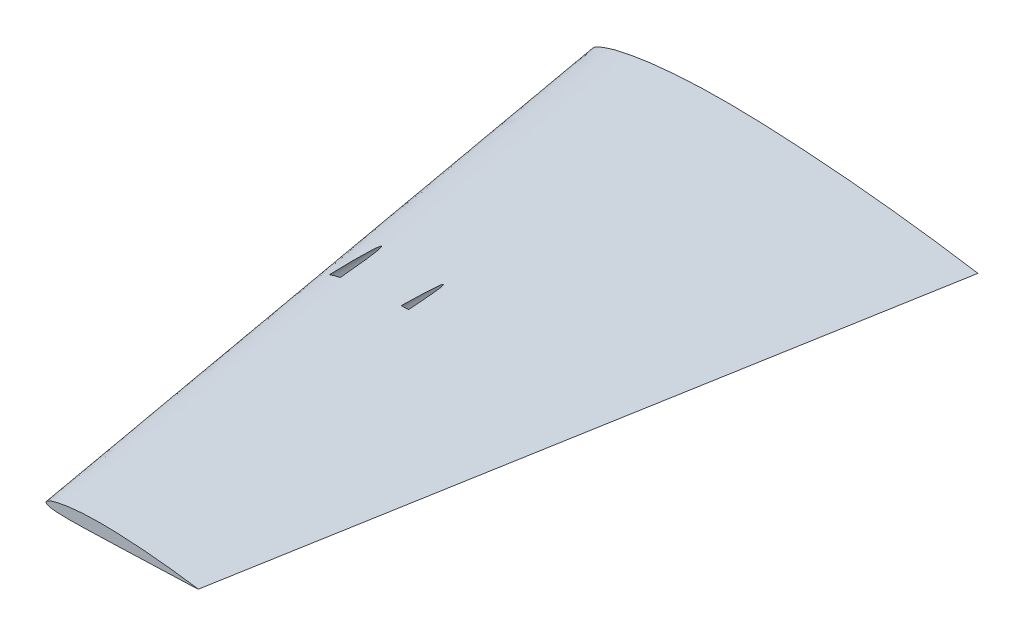
from build123d import *

# Parameters (mm, degrees)
SKETCH10_R         = 3.556
CUT_EXTRUDE1_DEPTH = 152.4


with BuildPart() as part:
    # Sketch8 → Loft1 section 0
    with BuildSketch(Plane.XY):
        with BuildLine():
            Line((168.851326, -0.385826), (177.8, 0.149352))
            add(Edge.make_bspline(
                [(177.8, 0.149352), (174.85719505, 0.612681625), (168.969063902, 1.539737833), (157.168969239, 3.240587373), (142.387066218, 5.13954993), (124.612423324, 7.068513988), (106.806810583, 8.63772838), (88.975151697, 9.799607557), (71.092038413, 10.550321324), (56.151211558, 10.603824175), (44.182140186, 10.140101011), (35.213135868, 9.51281635), (26.259336774, 8.559807876), (18.830232793, 7.418999987), (12.913992759, 6.19236398), (8.487379341, 5.125518549), (4.793933355, 3.700021616), (1.828725111, 2.565322597), (-1.179273917, -0.123552283), (2.299923854, -2.129309552), (5.372172766, -2.815648506), (9.249075669, -3.41893056), (13.717870066, -3.774996411), (19.665331559, -4.065076307), (27.050573326, -4.189635193), (35.893379779, -4.142482213), (44.710709428, -3.990841299), (56.450763234, -3.71017542), (71.156708176, -3.327900411), (88.837724704, -2.833388525), (106.56851179, -2.244577125), (124.325007347, -1.669961057), (142.113106472, -1.122128513), (156.958652889, -0.706609276), (165.875537757, -0.466092488), (168.851326, -0.385826)],
                knots=[0, 0, 0, 0, 0.025515847, 0.051053555, 0.102111638, 0.153156699, 0.204180549, 0.255198388, 0.306198821, 0.357469284, 0.383114063, 0.40877782, 0.434465464, 0.460211087, 0.473144435, 0.486143689, 0.499400539, 0.50617272, 0.51522045, 0.524256147, 0.531058294, 0.544124426, 0.556970371, 0.569702534, 0.595038372, 0.620262586, 0.645429078, 0.670573489, 0.720845486, 0.771430884, 0.82207272, 0.872795898, 0.923597706, 0.974502637, 1, 1, 1, 1], degree=3))
        make_face()
    # Sketch9 → Loft1 section 1
    with BuildSketch(Plane.XY.offset(304.8)):
        with BuildLine():
            Line((120.424928473, -0.441094427), (123.952, -0.210449087))
            add(Edge.make_bspline(
                [(123.952, -0.210449087), (122.790706344, -0.034227303), (120.467124094, 0.318367243), (115.810899398, 0.963076187), (109.978584953, 1.679352822), (102.966239644, 2.40089085), (95.942473132, 2.980520314), (88.909331139, 3.399490187), (81.856804208, 3.656234557), (75.965879739, 3.644542263), (71.247781696, 3.435441672), (67.712896541, 3.168436286), (64.184721229, 2.773039238), (61.258108484, 2.306943314), (58.928169788, 1.810327369), (57.185204224, 1.379981926), (55.732095913, 0.809837774), (54.565476004, 0.355946309), (53.385395312, -0.710813052), (54.761560507, -1.493999694), (55.974380176, -1.757864608), (57.504273209, -1.987216405), (59.266992249, -2.117797938), (61.612569196, -2.219117915), (64.524664938, -2.252021794), (68.011066404, -2.214025251), (71.487193687, -2.13488755), (76.115397351, -1.998464595), (81.912757256, -1.81547106), (88.882869709, -1.581696534), (95.872398553, -1.31063277), (102.872094777, -1.045109464), (109.884310301, -0.790076903), (115.736638741, -0.59366962), (119.251823206, -0.479271838), (120.424928473, -0.441094427)],
                knots=[0, 0, 0, 0, 0.025515847, 0.051053555, 0.102111638, 0.153156699, 0.204180549, 0.255198388, 0.306198821, 0.357469284, 0.383114063, 0.40877782, 0.434465464, 0.460211087, 0.473144435, 0.486143689, 0.499400539, 0.50617272, 0.51522045, 0.524256147, 0.531058294, 0.544124426, 0.556970371, 0.569702534, 0.595038372, 0.620262586, 0.645429078, 0.670573489, 0.720845486, 0.771430884, 0.82207272, 0.872795898, 0.923597706, 0.974502637, 1, 1, 1, 1], degree=3))
        make_face()
    loft()

    # Sketch10 → Cut-Extrude1 (cut)
    with BuildSketch(Plane(origin=(0, 0, 0), x_dir=(-1, 0, 0), z_dir=(0, 0, -1))):
        with Locations((-66.614590832, 3.923597416)):
            Circle(SKETCH10_R)
        with Locations((-34.985409168, 1.156402584)):
            Circle(SKETCH10_R)
    extrude(amount=-CUT_EXTRUDE1_DEPTH, mode=Mode.SUBTRACT)


solid = part.part
